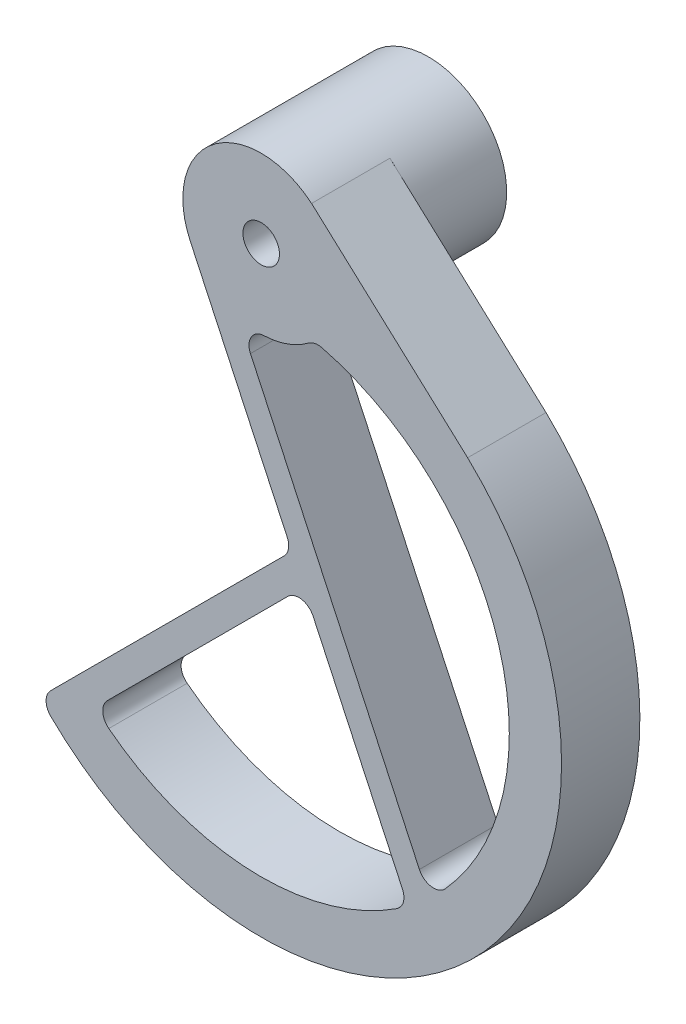
from build123d import *

# Parameters (mm, degrees)
EXTRUDE_1_DEPTH     = 15
SKETCH_6_R          = 3.5
CUT_EXTRUDE_2_DEPTH = 15
EXTRUDE_START       = 17
SKETCH_11_R         = 15
SKETCH_11_R_2       = 3.5
EXTRUDE_3_DEPTH     = 17
SKETCH_12_R         = 10.1
CUT_EXTRUDE_6_DEPTH = 2


with BuildPart() as part:
    # ｽｹｯﾁ1 → ﾎﾞｽ - 押し出し1 (new body)
    with BuildSketch(Plane.XY):
        with BuildLine():
            Line((10.546944731, 68.165925034), (9.641814145, 68.990666647))
            ThreePointArc((9.641814145, 68.990666647), (-9.131421435, 69.400300104), (-13.594616806, 51.160726074))
            Line((-13.594616806, 51.160726074), (4.986432096, 11.313538113))
            ThreePointArc((4.986432096, 11.313538113), (5.221931994, 9.524738795), (4.388829079, 7.924362985))
            Line((4.388829079, 7.924362985), (-40.303464689, -36.767930783))
            ThreePointArc((-40.303464689, -36.767930783), (-41.182112782, -38.903012739), (-40.283913759, -41.029943849))
            ThreePointArc((-40.283913759, -41.029943849), (41.397896806, -39.905690573), (39.524106652, 41.762363359))
            Line((39.524106652, 41.762363359), (37.916838192, 43.226882625))
            Line((37.916838192, 43.226882625), (10.546944731, 68.165925034))
        make_face()
        with BuildLine():
            ThreePointArc((5.093338956, 1.55780505), (7.735603832, 2.390907965), (9.933582661, 0.704339492))
            Line((9.933582661, 0.704339492), (27.046217634, -35.993824637))
            ThreePointArc((27.046217634, -35.993824637), (27.212084573, -38.085077821), (25.967336583, -39.773702754))
            ThreePointArc((25.967336583, -39.773702754), (-1.972837213, -47.459012983), (-29.17877254, -37.481318454))
            ThreePointArc((-29.17877254, -37.481318454), (-30.330146685, -35.299826939), (-29.457223039, -32.992756945))
            Line((-29.457223039, -32.992756945), (5.093338956, 1.55780505))
        make_face(mode=Mode.SUBTRACT)
        with BuildLine():
            ThreePointArc((35.231836325, -31.858557864), (32.560090836, -32.813013733), (30.287744354, -31.114293205))
            Line((30.287744354, -31.114293205), (-2.054746852, 38.244403012))
            ThreePointArc((-2.054746852, 38.244403012), (-1.895310582, 41.077194163), (0.553480425, 42.510214831))
            ThreePointArc((0.553480425, 42.510214831), (5.039223996, 43.371793408), (9.057681155, 45.543478261))
            ThreePointArc((9.057681155, 45.543478261), (10.270904088, 46.091905397), (11.601973614, 46.061309233))
            ThreePointArc((11.601973614, 46.061309233), (45.455779175, 13.784851815), (35.231836325, -31.858557864))
        make_face(mode=Mode.SUBTRACT)
    extrude(amount=EXTRUDE_1_DEPTH)

    # ｽｹｯﾁ6 → ｶｯﾄ - 押し出し2 (cut)
    with BuildSketch(Plane.XY.offset(15)):
        with Locations((0, 57.5)):
            Circle(SKETCH_6_R)
    extrude(amount=-CUT_EXTRUDE_2_DEPTH, mode=Mode.SUBTRACT)

    # ｽｹｯﾁ11 → ﾎﾞｽ - 押し出し3 (add)
    with BuildSketch(Plane(origin=(0, 0, 0), x_dir=(-1, 0, 0), z_dir=(0, 0, -1)).offset(EXTRUDE_START)):
        with Locations((0, 57.5)):
            Circle(SKETCH_11_R)
        with Locations((0, 57.5)):
            Circle(SKETCH_11_R_2, mode=Mode.SUBTRACT)
    extrude(amount=-EXTRUDE_3_DEPTH)

    # ｽｹｯﾁ12 → ｶｯﾄ - 押し出し6 (cut)
    with BuildSketch(Plane(origin=(0, 0, -17), x_dir=(-1, 0, 0), z_dir=(0, 0, -1))):
        with Locations((0, 57.5)):
            Circle(SKETCH_12_R)
    extrude(amount=-CUT_EXTRUDE_6_DEPTH, mode=Mode.SUBTRACT)


solid = part.part
